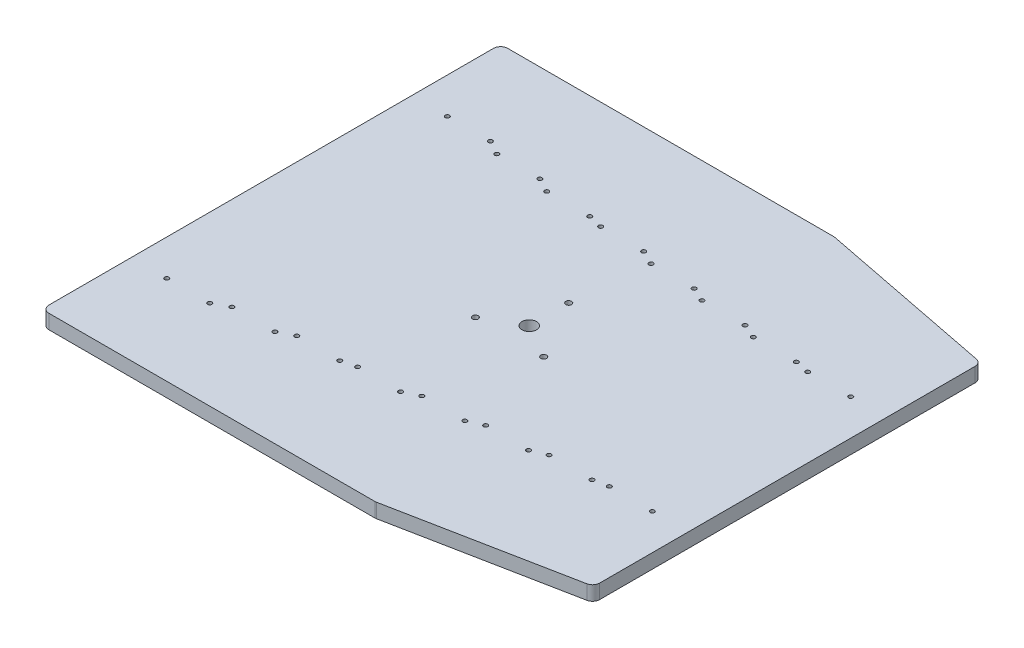
from build123d import *

# Parameters (mm, degrees)
SKETCH1_W              = 457.2
SKETCH1_H              = 406.4
BOSS_EXTRUDE1_DEPTH    = 12.7
F_6_CLEARANCE_HOLE1_D  = 3.7973
SKETCH5_R              = 6.4135
CUT_EXTRUDE2_DEPTH     = 307.120058147
CUT_EXTRUDE3_DEPTH     = 3.175
F_10_CLEARANCE_HOLE1_D = 5.1054
CUT_EXTRUDE4_DEPTH     = 307.120058147
FILLET1_R              = 6.35


with BuildPart() as part:
    # Sketch1 → Boss-Extrude1 (new body)
    with BuildSketch(Plane(origin=(0, 0, 0), x_dir=(1, 0, 0), z_dir=(0, 1, 0))):
        Rectangle(SKETCH1_W, SKETCH1_H)
    extrude(amount=BOSS_EXTRUDE1_DEPTH)

    # #6 Clearance Hole1 (through all)
    with Locations(Plane(origin=(0, 0, 0), x_dir=(-1, 0, 0), z_dir=(0, -1, 0))):
        with Locations((-196.85, 87.87638), (-158.75, 87.87638), (-146.05, 90.45448), (-107.95, 90.45448), (-95.25, 95.83166), (-57.15, 95.83166), (-44.45, 101.50348), (-6.35, 101.50348), (6.35, 107.61726), (44.45, 107.61726), (57.15, 110.71098), (95.25, 110.71098), (107.95, 117.34038), (146.05, 117.34038), (158.75, 124.26442), (196.85, 124.26442), (196.85, -124.26442), (158.75, -124.26442), (146.05, -117.34038), (107.95, -117.34038), (95.25, -110.71098), (57.15, -110.71098), (44.45, -107.61726), (6.35, -107.61726), (-6.35, -101.50348), (-44.45, -101.50348), (-57.15, -95.83166), (-95.25, -95.83166), (-107.95, -90.45448), (-146.05, -90.45448), (-158.75, -87.87638), (-196.85, -87.87638)):
            Hole(F_6_CLEARANCE_HOLE1_D / 2)

    # Sketch5 → Cut-Extrude2 (cut, through all)
    with BuildSketch(Plane.XZ):
        Circle(SKETCH5_R)
    extrude(amount=-CUT_EXTRUDE2_DEPTH, mode=Mode.SUBTRACT)

    # Sketch6 → Cut-Extrude3 (cut)
    with BuildSketch(Plane.XZ):
        Polygon((-192.913, -121.99139199), (-196.85, -119.71836398), (-200.787, -121.99139199), (-200.787, -126.53744801), (-196.85, -128.81047602), (-192.913, -126.53744801), align=None)
    cut_extrude3 = extrude(amount=-CUT_EXTRUDE3_DEPTH, mode=Mode.SUBTRACT)

    # Sketch-Pattern1: Cut-Extrude3 at 31 more places
    with Locations((393.7, 0, 36.38804), (355.6, 0, 36.38804), (342.9, 0, 33.80994), (304.8, 0, 33.80994), (292.1, 0, 28.43276), (254, 0, 28.43276), (241.3, 0, 22.76094), (203.2, 0, 22.76094), (190.5, 0, 16.64716), (152.4, 0, 16.64716), (139.7, 0, 13.55344), (101.6, 0, 13.55344), (88.9, 0, 6.92404), (50.8, 0, 6.92404), (38.1, 0, 0), (0, 0, 248.52884), (38.1, 0, 248.52884), (50.8, 0, 241.6048), (88.9, 0, 241.6048), (101.6, 0, 234.9754), (139.7, 0, 234.9754), (152.4, 0, 231.88168), (190.5, 0, 231.88168), (203.2, 0, 225.7679), (241.3, 0, 225.7679), (254, 0, 220.09608), (292.1, 0, 220.09608), (304.8, 0, 214.7189), (342.9, 0, 214.7189), (355.6, 0, 212.1408), (393.7, 0, 212.1408)):
        add(cut_extrude3, mode=Mode.SUBTRACT)

    # #10 Clearance Hole1 (through all)
    with Locations(Plane(origin=(0, 12.7, 0), x_dir=(1, 0, 0), z_dir=(0, 1, 0))):
        with Locations((-30.245937227, -17.4625), (0, 34.925), (30.245937227, -17.4625)):
            Hole(F_10_CLEARANCE_HOLE1_D / 2)

    # Sketch10 → Cut-Extrude4 (cut, through all)
    with BuildSketch(Plane(origin=(0, 12.7, 0), x_dir=(1, 0, 0), z_dir=(0, 1, 0))):
        Polygon((67.035234154, -203.2), (228.6, -171.45), (228.6, -203.2), align=None)
        Polygon((228.6, 203.2), (67.035234154, 203.2), (228.6, 171.45), align=None)
    extrude(amount=-CUT_EXTRUDE4_DEPTH, mode=Mode.SUBTRACT)

    # Fillet1
    fillet1_edges = [part.edges().sort_by_distance(p)[0] for p in [
        (-228.6, 6.35, 203.2),
        (-228.6, 6.35, -203.2),
        (228.6, 6.35, -171.45),
        (228.6, 6.35, 171.45),
        (67.035234154, 6.35, -203.2),
        (67.035234154, 6.35, 203.2),
    ]]
    fillet(fillet1_edges, radius=FILLET1_R)


solid = part.part
